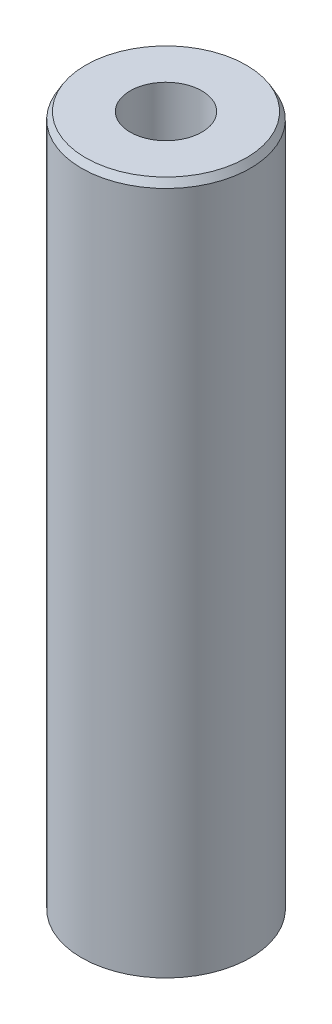
from build123d import *
from OCP.BRepFilletAPI import BRepFilletAPI_MakeChamfer

# Parameters (mm, degrees)
SKETCH1_R           = 57.5
BOSS_EXTRUDE1_DEPTH = 473.390255606
SKETCH2_R           = 24.423012745
CUT_EXTRUDE1_DEPTH  = 481.323676392
CHAMFER1_SIZE       = 4.789236921
CHAMFER1_SIZE2      = 2.765067226


with BuildPart() as part:
    # Sketch1 → Boss-Extrude1 (new body)
    with BuildSketch(Plane(origin=(0, 0, 0), x_dir=(1, 0, 0), z_dir=(0, 1, 0))):
        Circle(SKETCH1_R)
    extrude(amount=BOSS_EXTRUDE1_DEPTH)

    # Sketch2 → Cut-Extrude1 (cut, through all)
    with BuildSketch(Plane(origin=(0, 0, 0), x_dir=(1, 0, 0), z_dir=(0, 1, 0))):
        Circle(SKETCH2_R)
    extrude(amount=CUT_EXTRUDE1_DEPTH, mode=Mode.SUBTRACT)

    # Chamfer1: one chamfer whose edges measure the first distance from different faces: ONE call of the kernel's chamfer builder (chamfer() names one face for all edges)
    chamfer1_edges_1 = [part.edges().sort_by_distance(p)[0] for p in [
        (-57.5, 473.390255606, 0),
    ]]
    chamfer1_side_1 = [part.faces().sort_by_distance(p)[0] for p in [
        (-57.5, 236.695127803, 0),
    ]]
    chamfer1_edges_2 = [part.edges().sort_by_distance(p)[0] for p in [
        (-57.5, 0, 0),
    ]]
    chamfer1_side_2 = [part.faces().sort_by_distance(p)[0] for p in [
        (-55.873654403, 0, 0),
    ]]
    chamfer1 = BRepFilletAPI_MakeChamfer(part.part.solid().wrapped)
    for e in chamfer1_edges_1:
        chamfer1.Add(CHAMFER1_SIZE, CHAMFER1_SIZE2, e.wrapped, chamfer1_side_1[0].wrapped)  # the first distance lies on this face
    for e in chamfer1_edges_2:
        chamfer1.Add(CHAMFER1_SIZE, CHAMFER1_SIZE2, e.wrapped, chamfer1_side_2[0].wrapped)  # the first distance lies on this face
    add(Compound.cast(chamfer1.Shape()), mode=Mode.REPLACE)


solid = part.part
